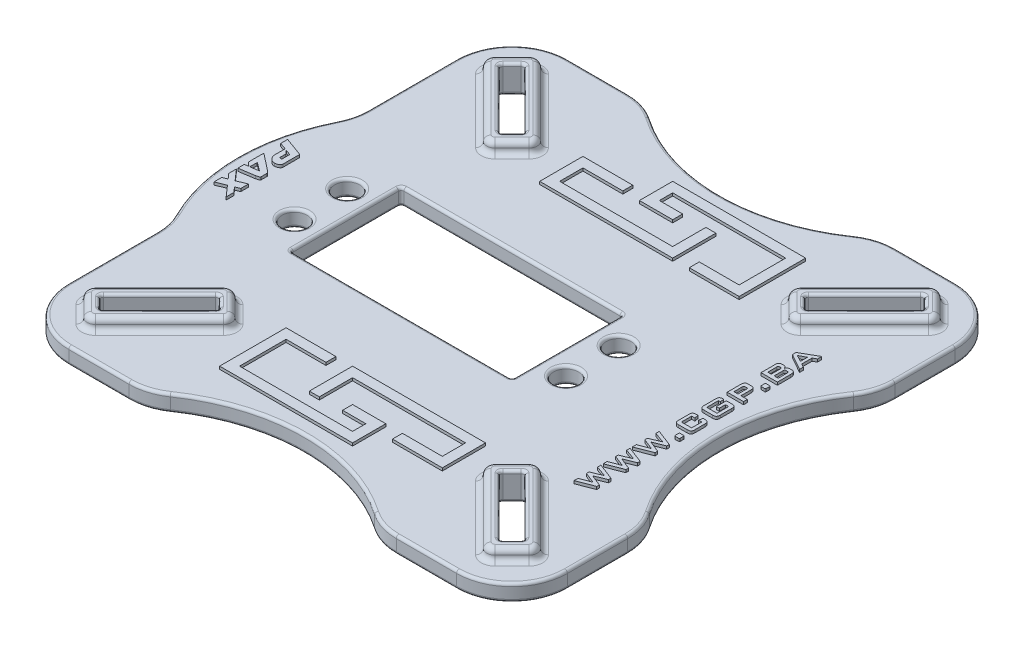
from build123d import *

# Parameters (mm, degrees)
SKETCH1_W           = 90
SKETCH1_H           = 90
SKETCH1_W_2         = 40
SKETCH1_H_2         = 20
BOSS_EXTRUDE1_DEPTH = 3
SKETCH2_R           = 2.25
CUT_EXTRUDE1_DEPTH  = 3
SKETCH3_R           = 32.5
CUT_EXTRUDE2_DEPTH  = 3
FILLET1_R           = 10
FILLET2_R           = 10
CUT_EXTRUDE3_DEPTH  = 3
FILLET3_R           = 10
BOSS_EXTRUDE2_DEPTH = 0.5
BOSS_EXTRUDE3_DEPTH = 2
FILLET4_R           = 1
BOSS_EXTRUDE4_DEPTH = 3
FILLET5_R           = 10
BOSS_EXTRUDE5_DEPTH = 0.5
BOSS_EXTRUDE6_DEPTH = 0.5
FILLET6_R           = 0.5


with BuildPart() as part:
    # Sketch1 → Boss-Extrude1 (new body)
    with BuildSketch(Plane(origin=(0, 0, 0), x_dir=(1, 0, 0), z_dir=(0, 1, 0))):
        Rectangle(SKETCH1_W, SKETCH1_H)
        with Locations((-10, 0)):
            Rectangle(SKETCH1_W_2, SKETCH1_H_2, mode=Mode.SUBTRACT)
    extrude(amount=BOSS_EXTRUDE1_DEPTH)

    # Sketch2 → Cut-Extrude1 (cut)
    with BuildSketch(Plane(origin=(0, 3, 0), x_dir=(1, 0, 0), z_dir=(0, 1, 0))):
        with Locations(Location((-34.5, 4.75, 0), (0, 0, 270))):
            Circle(SKETCH2_R)
        with Locations(Location((-34.5, -4.75, 0), (0, 0, 270))):
            Circle(SKETCH2_R)
        with Locations(Location((14.5, 4.75, 0), (0, 0, 270))):
            Circle(SKETCH2_R)
        with Locations(Location((14.5, -4.75, 0), (0, 0, 270))):
            Circle(SKETCH2_R)
    extrude(amount=-CUT_EXTRUDE1_DEPTH, mode=Mode.SUBTRACT)

    # Sketch3 → Cut-Extrude2 (cut)
    with BuildSketch(Plane(origin=(0, 3, 0), x_dir=(1, 0, 0), z_dir=(0, 1, 0))):
        with Locations((0, 70)):
            Circle(SKETCH3_R)
        with Locations((70, 0)):
            Circle(SKETCH3_R)
        with Locations((0, -70)):
            Circle(SKETCH3_R)
    extrude(amount=-CUT_EXTRUDE2_DEPTH, mode=Mode.SUBTRACT)

    # Fillet1
    fillet1_edges = [part.edges().sort_by_distance(p)[0] for p in [
        (45, 1.5, 45),
        (-45, 1.5, 45),
        (-45, 1.5, -45),
        (45, 1.5, -45),
    ]]
    fillet(fillet1_edges, radius=FILLET1_R)

    # Fillet2
    fillet2_edges = [part.edges().sort_by_distance(p)[0] for p in [
        (45, 1.5, -20.766559657),
        (45, 1.5, 20.766559657),
    ]]
    fillet(fillet2_edges, radius=FILLET2_R)

    # Sketch4 → Cut-Extrude3 (cut)
    with BuildSketch(Plane(origin=(0, 3, 0), x_dir=(1, 0, 0), z_dir=(0, 1, 0))):
        Polygon((-38.395898218, 36.062445841), (-27.577164466, 25.243712088), (-25.243712088, 27.577164466), (-36.062445841, 38.395898218), align=None)
        Polygon((36.062445841, 38.395898218), (25.243712088, 27.577164466), (27.577164466, 25.243712088), (38.395898218, 36.062445841), align=None)
        Polygon((38.395898218, -36.062445841), (27.577164466, -25.243712088), (25.243712088, -27.577164466), (36.062445841, -38.395898218), align=None)
        Polygon((-36.062445841, -38.395898218), (-25.243712088, -27.577164466), (-27.577164466, -25.243712088), (-38.395898218, -36.062445841), align=None)
    extrude(amount=-CUT_EXTRUDE3_DEPTH, mode=Mode.SUBTRACT)

    # Fillet3
    fillet3_edges = [part.edges().sort_by_distance(p)[0] for p in [
        (-20.766559657, 1.5, -45),
        (20.766559657, 1.5, -45),
        (20.766559657, 1.5, 45),
        (-20.766559657, 1.5, 45),
    ]]
    fillet(fillet3_edges, radius=FILLET3_R)

    # Sketch5 → Boss-Extrude2 (add)
    with BuildSketch(Plane(origin=(0, 3, 0), x_dir=(1, 0, 0), z_dir=(0, 1, 0))):
        Polygon((-5.804155939, -22.975641645), (-5.804155939, -30.775641645), (-4.004155939, -30.775641645), (-4.004155939, -24.775641645), (16.395844061, -24.775641645), (16.395844061, -28.975641645), (9.195844061, -28.975641645), (9.195844061, -30.775641645), (18.195844061, -30.775641645), (18.195844061, -22.975641645), align=None)
        Polygon((-17.804155939, -22.975641645), (-17.804155939, -34.975641645), (6.195844061, -34.975641645), (6.195844061, -28.975641645), (0.195844061, -28.975641645), (0.195844061, -30.775641645), (4.395844061, -30.775641645), (4.395844061, -33.175641645), (-16.004155939, -33.175641645), (-16.004155939, -24.775641645), (-8.804155939, -24.775641645), (-8.804155939, -22.975641645), align=None)
        Polygon((6.195844061, 22.80503103), (6.195844061, 30.60503103), (4.395844061, 30.60503103), (4.395844061, 24.60503103), (-16.004155939, 24.60503103), (-16.004155939, 28.80503103), (-8.804155939, 28.80503103), (-8.804155939, 30.60503103), (-17.804155939, 30.60503103), (-17.804155939, 22.80503103), align=None)
        Polygon((18.195844061, 22.80503103), (18.195844061, 34.80503103), (-5.804155939, 34.80503103), (-5.804155939, 28.80503103), (0.195844061, 28.80503103), (0.195844061, 30.60503103), (-4.004155939, 30.60503103), (-4.004155939, 33.00503103), (16.395844061, 33.00503103), (16.395844061, 24.60503103), (9.195844061, 24.60503103), (9.195844061, 22.80503103), align=None)
    extrude(amount=BOSS_EXTRUDE2_DEPTH)

    # Sketch6 → Boss-Extrude3 (add)
    # profile 1 of 4: a face of its own
    with BuildSketch(Plane(origin=(0, 3, 0), x_dir=(1, 0, 0), z_dir=(0, 1, 0))):
        with BuildLine():
            Line((-26.516504294, 23.475945135), (-23.475945135, 26.516504294))
            ThreePointArc((-23.475945135, 26.516504294), (-23.036605307, 27.577164466), (-23.475945135, 28.637824638))
            Line((-23.475945135, 28.637824638), (-35.001785669, 40.163665171))
            ThreePointArc((-35.001785669, 40.163665171), (-36.062445841, 40.603005), (-37.123106012, 40.163665171))
            Line((-37.123106012, 40.163665171), (-40.163665171, 37.123106012))
            ThreePointArc((-40.163665171, 37.123106012), (-40.603005, 36.062445841), (-40.163665171, 35.001785669))
            Line((-40.163665171, 35.001785669), (-28.637824638, 23.475945135))
            ThreePointArc((-28.637824638, 23.475945135), (-27.577164466, 23.036605307), (-26.516504294, 23.475945135))
        make_face()
        Polygon((-27.577164466, 25.243712088), (-25.243712088, 27.577164466), (-36.062445841, 38.395898218), (-38.395898218, 36.062445841), align=None, mode=Mode.SUBTRACT)
    # profile 2 of 4: a face of its own
    with BuildSketch(Plane(origin=(0, 3, 0), x_dir=(1, 0, 0), z_dir=(0, 1, 0))):
        with BuildLine():
            Line((23.475945135, 26.516504294), (26.516504294, 23.475945135))
            ThreePointArc((26.516504294, 23.475945135), (27.577164466, 23.036605307), (28.637824638, 23.475945135))
            Line((28.637824638, 23.475945135), (40.163665171, 35.001785669))
            ThreePointArc((40.163665171, 35.001785669), (40.603005, 36.062445841), (40.163665171, 37.123106012))
            Line((40.163665171, 37.123106012), (37.123106012, 40.163665171))
            ThreePointArc((37.123106012, 40.163665171), (36.062445841, 40.603005), (35.001785669, 40.163665171))
            Line((35.001785669, 40.163665171), (23.475945135, 28.637824638))
            ThreePointArc((23.475945135, 28.637824638), (23.036605307, 27.577164466), (23.475945135, 26.516504294))
        make_face()
        Polygon((25.243712088, 27.577164466), (27.577164466, 25.243712088), (38.395898218, 36.062445841), (36.062445841, 38.395898218), align=None, mode=Mode.SUBTRACT)
    # profile 3 of 4: a face of its own
    with BuildSketch(Plane(origin=(0, 3, 0), x_dir=(1, 0, 0), z_dir=(0, 1, 0))):
        with BuildLine():
            Line((26.516504294, -23.475945135), (23.475945135, -26.516504294))
            ThreePointArc((23.475945135, -26.516504294), (23.036605307, -27.577164466), (23.475945135, -28.637824638))
            Line((23.475945135, -28.637824638), (35.001785669, -40.163665171))
            ThreePointArc((35.001785669, -40.163665171), (36.062445841, -40.603005), (37.123106012, -40.163665171))
            Line((37.123106012, -40.163665171), (40.163665171, -37.123106012))
            ThreePointArc((40.163665171, -37.123106012), (40.603005, -36.062445841), (40.163665171, -35.001785669))
            Line((40.163665171, -35.001785669), (28.637824638, -23.475945135))
            ThreePointArc((28.637824638, -23.475945135), (27.577164466, -23.036605307), (26.516504294, -23.475945135))
        make_face()
        Polygon((27.577164466, -25.243712088), (25.243712088, -27.577164466), (36.062445841, -38.395898218), (38.395898218, -36.062445841), align=None, mode=Mode.SUBTRACT)
    # profile 4 of 4: a face of its own
    with BuildSketch(Plane(origin=(0, 3, 0), x_dir=(1, 0, 0), z_dir=(0, 1, 0))):
        with BuildLine():
            Line((-23.475945135, -26.516504294), (-26.516504294, -23.475945135))
            ThreePointArc((-26.516504294, -23.475945135), (-27.577164466, -23.036605307), (-28.637824638, -23.475945135))
            Line((-28.637824638, -23.475945135), (-40.163665171, -35.001785669))
            ThreePointArc((-40.163665171, -35.001785669), (-40.603005, -36.062445841), (-40.163665171, -37.123106012))
            Line((-40.163665171, -37.123106012), (-37.123106012, -40.163665171))
            ThreePointArc((-37.123106012, -40.163665171), (-36.062445841, -40.603005), (-35.001785669, -40.163665171))
            Line((-35.001785669, -40.163665171), (-23.475945135, -28.637824638))
            ThreePointArc((-23.475945135, -28.637824638), (-23.036605307, -27.577164466), (-23.475945135, -26.516504294))
        make_face()
        Polygon((-25.243712088, -27.577164466), (-27.577164466, -25.243712088), (-38.395898218, -36.062445841), (-36.062445841, -38.395898218), align=None, mode=Mode.SUBTRACT)
    extrude(amount=BOSS_EXTRUDE3_DEPTH)

    # Fillet4
    fillet4_edges = [part.edges().sort_by_distance(p)[0] for p in [
        (-27.577164466, 3, -23.036605307),
        (-34.400744905, 3, -29.238865402),
        (-40.603005, 3, -36.062445841),
        (-38.643385592, 3, -38.643385592),
        (-36.062445841, 3, -40.603005),
        (-29.238865402, 3, -34.400744905),
        (-23.036605307, 3, -27.577164466),
        (-27.577164466, 5, -23.036605307),
        (-34.400744905, 5, -29.238865402),
        (-40.603005, 5, -36.062445841),
        (-38.643385592, 5, -38.643385592),
        (-36.062445841, 5, -40.603005),
        (-29.238865402, 5, -34.400744905),
        (-23.036605307, 5, -27.577164466),
        (-24.996224715, 3, -24.996224715),
        (-24.996224715, 5, -24.996224715),
        (27.577164466, 5, -23.036605307),
        (24.996224715, 5, -24.996224715),
        (23.036605307, 5, -27.577164466),
        (29.238865402, 5, -34.400744905),
        (36.062445841, 5, -40.603005),
        (38.643385592, 5, -38.643385592),
        (40.603005, 5, -36.062445841),
        (27.577164466, 3, -23.036605307),
        (24.996224715, 3, -24.996224715),
        (23.036605307, 3, -27.577164466),
        (29.238865402, 3, -34.400744905),
        (36.062445841, 3, -40.603005),
        (38.643385592, 3, -38.643385592),
        (40.603005, 3, -36.062445841),
        (36.062445841, 5, 40.603005),
        (29.238865402, 5, 34.400744905),
        (23.036605307, 5, 27.577164466),
        (24.996224715, 5, 24.996224715),
        (27.577164466, 5, 23.036605307),
        (34.400744905, 5, 29.238865402),
        (40.603005, 5, 36.062445841),
        (36.062445841, 3, 40.603005),
        (29.238865402, 3, 34.400744905),
        (23.036605307, 3, 27.577164466),
        (24.996224715, 3, 24.996224715),
        (27.577164466, 3, 23.036605307),
        (34.400744905, 3, 29.238865402),
        (40.603005, 3, 36.062445841),
        (-36.062445841, 3, 40.603005),
        (-38.643385592, 3, 38.643385592),
        (-40.603005, 3, 36.062445841),
        (-34.400744905, 3, 29.238865402),
        (-27.577164466, 3, 23.036605307),
        (-24.996224715, 3, 24.996224715),
        (-23.036605307, 3, 27.577164466),
        (-27.577164466, 5, 23.036605307),
        (-24.996224715, 5, 24.996224715),
        (-23.036605307, 5, 27.577164466),
        (-29.238865402, 5, 34.400744905),
        (-36.062445841, 5, 40.603005),
        (-38.643385592, 5, 38.643385592),
        (-40.603005, 5, 36.062445841),
        (34.400744905, 5, -29.238865402),
        (34.400744905, 3, -29.238865402),
        (38.643385592, 5, 38.643385592),
        (38.643385592, 3, 38.643385592),
        (-29.238865402, 3, 34.400744905),
        (-34.400744905, 5, 29.238865402),
    ]]
    fillet(fillet4_edges, radius=FILLET4_R - 0.0001)  # a hair under: the kernel refuses the full size

    # Sketch7 → Boss-Extrude4 (add)
    with BuildSketch(Plane(origin=(0, 3, 0), x_dir=(1, 0, 0), z_dir=(0, 1, 0))):
        with BuildLine():
            Line((-41.273263341, 21.611540592), (-41.273263341, -21.611540592))
            ThreePointArc((-41.273263341, -21.611540592), (-49.5, 0), (-41.273263341, 21.611540592))
        make_face()
    extrude(amount=-BOSS_EXTRUDE4_DEPTH)

    # Fillet5
    fillet5_edges = [part.edges().sort_by_distance(p)[0] for p in [
        (-45, 1.5, 16.5),
        (-45, 1.5, -16.5),
    ]]
    fillet(fillet5_edges, radius=FILLET5_R)

    # Sketch8 → Boss-Extrude5 (add)
    # profile 1 of 3: a face of its own
    with BuildSketch(Plane(origin=(0, 3, 0), x_dir=(1, 0, 0), z_dir=(0, 1, 0))):
        with BuildLine():
            Line((-47.108931318, 6.608732596), (-47.108931318, 5.362670056))
            Line((-47.108931318, 5.362670056), (-45.862868778, 4.909129584))
            Line((-45.862868778, 4.909129584), (-45.862868778, 3.084638616))
            add(Edge.make_bspline(
                [(-45.862868778, 3.084638616), (-45.861736027, 3.04733525), (-45.85944029, 2.971732828), (-45.841885174, 2.857171017), (-45.811998937, 2.740671177), (-45.773186017, 2.622407022), (-45.72381782, 2.505260558), (-45.663156967, 2.392722396), (-45.594546515, 2.284139263), (-45.516969245, 2.181172785), (-45.43052043, 2.085047673), (-45.335677636, 1.997915242), (-45.233298758, 1.919289071), (-45.124349464, 1.849698208), (-45.007842689, 1.79272351), (-44.884658328, 1.752324001), (-44.755871207, 1.727004154), (-44.667942266, 1.723775492), (-44.623379289, 1.722139185)],
                knots=[0, 0, 0, 0, 0.885232018, 1.794092422, 2.74370176, 3.737504989, 4.746220302, 5.756630523, 6.768623733, 7.792411344, 8.812931898, 9.832965549, 10.844931487, 11.873452655, 12.896889759, 13.914187024, 14.942896008, 16, 16, 16, 16], degree=3))
            add(Edge.make_bspline(
                [(-44.623379289, 1.722139185), (-44.576969157, 1.724377243), (-44.477580661, 1.729170103), (-44.324379467, 1.755790649), (-44.166396505, 1.799628526), (-44.039849555, 1.856292047), (-43.946422866, 1.912456004), (-43.880593147, 1.958987768), (-43.822842666, 2.013689613), (-43.768491155, 2.070895923), (-43.722922406, 2.136125382), (-43.692502782, 2.210583451), (-43.672914278, 2.291740817), (-43.670562542, 2.348337007), (-43.669347985, 2.377566203)],
                knots=[0, 0, 0, 0, 1.308009427, 2.801135996, 4.369663069, 5.916778013, 6.688020193, 7.439397846, 8.1820322, 8.924666554, 9.660833723, 10.407644319, 11.177625268, 12, 12, 12, 12], degree=3))
            Line((-43.669347985, 2.377566203), (-43.669347985, 5.356097006))
            Line((-43.669347985, 5.356097006), (-47.108931318, 6.608732596))
        make_face()
        with BuildLine():
            Line((-44.552014742, 4.434930954), (-44.552014742, 3.104357767))
            add(Edge.make_bspline(
                [(-44.552014742, 3.104357767), (-44.553149477, 3.101471905), (-44.556335552, 3.093369063), (-44.567935861, 3.080766339), (-44.584680679, 3.062570121), (-44.615127209, 3.035603934), (-44.650765139, 3.00340377), (-44.681701473, 2.983265015), (-44.694743835, 2.974774775)],
                knots=[0, 0, 0, 0, 0.285507545, 0.801640219, 1.560352315, 2.586084273, 4.560736923, 6, 6, 6, 6], degree=3))
            add(Edge.make_bspline(
                [(-44.694743835, 2.974774775), (-44.695681011, 2.97445467), (-44.699997222, 2.972980412), (-44.707992444, 2.97113648), (-44.718255251, 2.967917144), (-44.723939854, 2.963668994), (-44.72667008, 2.961628674)],
                knots=[0, 0, 0, 0, 0.341080736, 1.57086482, 2.83332438, 4, 4, 4, 4], degree=3))
            Line((-44.72667008, 2.961628674), (-44.759535331, 2.974774775))
            add(Edge.make_bspline(
                [(-44.759535331, 2.974774775), (-44.767450483, 2.978038241), (-44.786796908, 2.986014891), (-44.816832897, 3.004977999), (-44.851997779, 3.027942728), (-44.889930934, 3.050861433), (-44.924584753, 3.076433006), (-44.955051123, 3.098136802), (-44.976440524, 3.115530801), (-44.984365981, 3.127125533), (-44.986775071, 3.130649968)],
                knots=[0, 0, 0, 0, 0.740198024, 1.809211804, 3.064644301, 4.380348615, 5.643654067, 6.787349711, 7.631392327, 8, 8, 8, 8], degree=3))
            Line((-44.986775071, 3.130649968), (-44.986775071, 4.169191919))
            Line((-44.986775071, 4.169191919), (-45.537972291, 4.791753686))
            Line((-45.537972291, 4.791753686), (-44.552014742, 4.434930954))
        make_face(mode=Mode.SUBTRACT)
    # profile 2 of 3: a face of its own
    with BuildSketch(Plane(origin=(0, 3, 0), x_dir=(1, 0, 0), z_dir=(0, 1, 0))):
        with BuildLine():
            Line((-47.108931318, -2.379444217), (-44.324775003, -1.951256939))
            add(Edge.make_bspline(
                [(-44.324775003, -1.951256939), (-44.295689199, -1.943656104), (-44.231936384, -1.926995929), (-44.130461502, -1.902643637), (-44.023365838, -1.871285088), (-43.917756706, -1.837497635), (-43.822713544, -1.795146356), (-43.753498335, -1.753181377), (-43.709771292, -1.714695617), (-43.686671907, -1.684600668), (-43.672398504, -1.65255852), (-43.670350422, -1.630556387), (-43.669347985, -1.619787401)],
                knots=[0, 0, 0, 0, 1.171376074, 2.567524768, 4.065186844, 5.519158832, 6.883790126, 8.111946179, 8.655860574, 9.143695796, 9.580880265, 10, 10, 10, 10], degree=3))
            Line((-43.669347985, -1.619787401), (-43.669347985, -0.529600055))
            add(Edge.make_bspline(
                [(-43.669347985, -0.529600055), (-43.672416061, -0.512311887), (-43.679718777, -0.471162139), (-43.720844719, -0.412660721), (-43.769549665, -0.34685948), (-43.827952777, -0.279839855), (-43.889794877, -0.215096686), (-43.951762384, -0.156591961), (-44.005618066, -0.107034392), (-44.042785701, -0.084431761), (-44.058096961, -0.075120575)],
                knots=[0, 0, 0, 0, 0.685403951, 1.631416428, 2.759305151, 3.931810397, 5.127528181, 6.288351481, 7.294883931, 8, 8, 8, 8], degree=3))
            Line((-44.058096961, -0.075120575), (-47.044139822, 2.261129311))
            Line((-47.044139822, 2.261129311), (-47.063858973, 2.261129311))
            add(Edge.make_bspline(
                [(-47.063858973, 2.261129311), (-47.063842362, 2.261453547), (-47.06368383, 2.264548055), (-47.075634168, 2.264615773), (-47.087982666, 2.269699951), (-47.101075574, 2.272559614), (-47.108931318, 2.274275412)],
                knots=[0, 0, 0, 0, 0.078778834, 0.751865482, 2.051119289, 4, 4, 4, 4], degree=3))
            Line((-47.108931318, 2.274275412), (-47.108931318, -0.471381609))
            add(Edge.make_bspline(
                [(-47.108931318, -0.471381609), (-47.104105699, -0.479949621), (-47.092483394, -0.500585326), (-47.066609674, -0.533110412), (-47.029107666, -0.570899021), (-46.967104727, -0.633897301), (-46.87539997, -0.71481517), (-46.759442619, -0.812681911), (-46.641498724, -0.90592592), (-46.547119358, -0.979255574), (-46.477286392, -1.028031408), (-46.43586052, -1.056424606), (-46.402759511, -1.075670734), (-46.383440319, -1.084649855), (-46.375566703, -1.088309332)],
                knots=[0, 0, 0, 0, 0.366921664, 0.88371573, 1.545270649, 2.355422292, 4.184658612, 6.10968203, 8.023168449, 9.800253548, 10.572220101, 11.20451281, 11.67579597, 12, 12, 12, 12], degree=3))
            Line((-46.375566703, -1.088309332), (-47.108931318, -1.224465374))
            Line((-47.108931318, -1.224465374), (-47.108931318, -2.379444217))
        make_face()
        Polygon((-46.174619165, 0.229117754), (-44.713523979, -0.861069592), (-46.239410661, -1.088309332), (-46.239410661, 0.229117754), align=None, mode=Mode.SUBTRACT)
    # profile 3 of 3: a face of its own
    with BuildSketch(Plane(origin=(0, 3, 0), x_dir=(1, 0, 0), z_dir=(0, 1, 0))):
        Polygon((-47.108931318, -4.023645805), (-46.284483006, -4.957957958), (-47.108931318, -5.295061539), (-47.108931318, -6.678219128), (-45.382097097, -5.983353808), (-43.669347985, -7.924281668), (-43.669347985, -6.535490035), (-44.480650196, -5.613384976), (-43.669347985, -5.289427496), (-43.669347985, -3.899696856), (-45.382097097, -4.594562176), (-47.108931318, -2.640488215), align=None)
    extrude(amount=BOSS_EXTRUDE5_DEPTH)

    # Sketch9 → Boss-Extrude6 (add)
    # profile 1 of 10: a face of its own
    with BuildSketch(Plane(origin=(0, 3, 0), x_dir=(1, 0, 0), z_dir=(0, 1, 0))):
        Polygon((35.029958163, 16.873825461), (32.081645446, 18.53471926), (32.081645446, 19.192002145), (35.029958163, 20.875107005), (35.029958163, 20.108414078), (34.398176866, 19.756327626), (34.398176866, 17.895534276), (35.029958163, 17.554142039), align=None)
        Polygon((33.871692453, 18.187568599), (33.871692453, 19.472519622), (32.659133037, 18.839915693), align=None, mode=Mode.SUBTRACT)
    # profile 2 of 10: a face of its own
    with BuildSketch(Plane(origin=(0, 3, 0), x_dir=(1, 0, 0), z_dir=(0, 1, 0))):
        with BuildLine():
            Line((35.029958163, 12.872543916), (32.081645446, 12.872543916))
            Line((32.081645446, 12.872543916), (32.081645446, 15.424348059))
            add(Edge.make_bspline(
                [(32.081645446, 15.424348059), (32.082178904, 15.452326389), (32.083210753, 15.506443894), (32.089398032, 15.584578226), (32.101312426, 15.65676485), (32.116080533, 15.72311247), (32.137133991, 15.783378452), (32.162270891, 15.837560316), (32.192194543, 15.885828416), (32.226349065, 15.928744631), (32.265946305, 15.965927848), (32.31126822, 15.997179992), (32.361108307, 16.024961853), (32.416775221, 16.04674482), (32.478114343, 16.06312775), (32.544386928, 16.075333373), (32.616187564, 16.082787917), (32.665695802, 16.083652946), (32.691215681, 16.08409884)],
                knots=[0, 0, 0, 0, 1.292127131, 2.499316392, 3.615120719, 4.668617248, 5.633707657, 6.557024253, 7.421415319, 8.250007142, 9.08313394, 9.919238431, 10.786314955, 11.712752044, 12.67117393, 13.714269832, 14.821780782, 16, 16, 16, 16], degree=3))
            Line((32.691215681, 16.08409884), (33.014510016, 16.08409884))
            add(Edge.make_bspline(
                [(33.014510016, 16.08409884), (33.047866265, 16.082713198), (33.112356165, 16.080034242), (33.203576399, 16.053926616), (33.284011359, 16.010903129), (33.353331241, 15.951403869), (33.410782351, 15.875524486), (33.455703457, 15.78473858), (33.488801204, 15.679482538), (33.500367383, 15.603902735), (33.506443891, 15.564195482)],
                knots=[0, 0, 0, 0, 1.005689471, 1.944367738, 2.837499614, 3.742233073, 4.681605481, 5.692907766, 6.787926245, 8, 8, 8, 8], degree=3))
            add(Edge.make_bspline(
                [(33.506443891, 15.564195482), (33.513334104, 15.603748908), (33.526538571, 15.679549444), (33.56703514, 15.784019404), (33.62074887, 15.87493371), (33.689913179, 15.950804169), (33.772575531, 16.010803023), (33.867283597, 16.054068921), (33.973692574, 16.080079824), (34.048406286, 16.082724738), (34.08722201, 16.08409884)],
                knots=[0, 0, 0, 0, 1.115241722, 2.137259083, 3.099377487, 4.039475274, 4.973823172, 5.923263124, 6.921080979, 8, 8, 8, 8], degree=3))
            Line((34.08722201, 16.08409884), (34.456583731, 16.08409884))
            add(Edge.make_bspline(
                [(34.456583731, 16.08409884), (34.480202886, 16.083510751), (34.526015156, 16.08237008), (34.592247388, 16.072327938), (34.653624056, 16.05603538), (34.710303094, 16.032748643), (34.762132564, 16.002984184), (34.810066729, 15.967448736), (34.851961262, 15.92381684), (34.890136182, 15.874367756), (34.922930288, 15.817699507), (34.951668504, 15.754851254), (34.976465098, 15.685569658), (34.995856204, 15.60920192), (35.011577407, 15.526262383), (35.02176509, 15.436341752), (35.028518795, 15.339719713), (35.029466991, 15.272996396), (35.029958163, 15.238433251)],
                knots=[0, 0, 0, 0, 0.97536779, 1.891846435, 2.760289993, 3.593432027, 4.415485166, 5.224395941, 6.04956588, 6.906104234, 7.799894245, 8.747834013, 9.758361408, 10.835533071, 11.9998569, 13.2434956, 14.57211144, 16, 16, 16, 16], degree=3))
            Line((35.029958163, 15.238433251), (35.029958163, 12.872543916))
        make_face()
        with BuildLine():
            Line((32.60812986, 15.134781632), (32.60812986, 13.556973654))
            Line((32.60812986, 13.556973654), (33.239911156, 13.556973654))
            Line((33.239911156, 13.556973654), (33.239911156, 15.134781632))
            add(Edge.make_bspline(
                [(33.239911156, 15.134781632), (33.239627422, 15.162507728), (33.23910615, 15.213445742), (33.230909879, 15.282857244), (33.218886594, 15.338948833), (33.199814255, 15.382620268), (33.173144538, 15.415152931), (33.138284535, 15.437228969), (33.09607054, 15.45058313), (33.065346078, 15.451716696), (33.049060556, 15.452317544)],
                knots=[0, 0, 0, 0, 1.562812498, 2.871178259, 3.936576838, 4.787800409, 5.534372869, 6.272243345, 7.084201431, 8, 8, 8, 8], degree=3))
            Line((33.049060556, 15.452317544), (32.79898046, 15.452317544))
            add(Edge.make_bspline(
                [(32.79898046, 15.452317544), (32.782949987, 15.451748304), (32.752725464, 15.450675035), (32.711074253, 15.436793707), (32.675801917, 15.415464094), (32.649027313, 15.38259082), (32.630161835, 15.338848687), (32.616784006, 15.283005379), (32.609052781, 15.213418185), (32.608455154, 15.162498015), (32.60812986, 15.134781632)],
                knots=[0, 0, 0, 0, 0.901900414, 1.700480689, 2.452627456, 3.200453804, 4.053107027, 5.123999521, 6.434562717, 8, 8, 8, 8], degree=3))
        make_face(mode=Mode.SUBTRACT)
        with BuildLine():
            Line((33.76639557, 15.134781632), (33.76639557, 13.556973654))
            Line((33.76639557, 13.556973654), (34.503473749, 13.556973654))
            Line((34.503473749, 13.556973654), (34.503473749, 15.134781632))
            add(Edge.make_bspline(
                [(34.503473749, 15.134781632), (34.503022525, 15.163335894), (34.502194213, 15.21575294), (34.49212427, 15.287014319), (34.474849093, 15.343850978), (34.448553733, 15.387623832), (34.411211997, 15.417757627), (34.364625356, 15.438720802), (34.307416793, 15.450297256), (34.265784325, 15.451613633), (34.24352207, 15.452317544)],
                knots=[0, 0, 0, 0, 1.422058343, 2.610471785, 3.574017487, 4.366266932, 5.113276298, 5.926342769, 6.89114706, 8, 8, 8, 8], degree=3))
            Line((34.24352207, 15.452317544), (34.023879353, 15.452317544))
            add(Edge.make_bspline(
                [(34.023879353, 15.452317544), (34.00159962, 15.451665848), (33.960202647, 15.450454962), (33.903215732, 15.438323347), (33.856437533, 15.41824028), (33.819642325, 15.387485284), (33.794194475, 15.3437499), (33.777999085, 15.286858771), (33.767586209, 15.215777124), (33.766815445, 15.163344423), (33.76639557, 15.134781632)],
                knots=[0, 0, 0, 0, 1.112017704, 2.066190281, 2.894031927, 3.632698836, 4.419968651, 5.382077697, 6.573882976, 8, 8, 8, 8], degree=3))
        make_face(mode=Mode.SUBTRACT)
    # profile 3 of 10: a face of its own
    with BuildSketch(Plane(origin=(0, 3, 0), x_dir=(1, 0, 0), z_dir=(0, 1, 0))):
        with BuildLine():
            Line((34.13493466, 11.366304914), (34.13493466, 11.470779165))
            add(Edge.make_bspline(
                [(34.13493466, 11.470779165), (34.135266523, 11.482621793), (34.135886047, 11.504729634), (34.14403873, 11.535308654), (34.158297492, 11.56001056), (34.178867573, 11.579803127), (34.207762674, 11.593759525), (34.245480871, 11.602994745), (34.292722731, 11.608454882), (34.327414124, 11.608795429), (34.346351057, 11.608981323)],
                knots=[0, 0, 0, 0, 0.968472643, 1.80794657, 2.563219161, 3.278323191, 4.112367477, 5.158759159, 6.449056578, 8, 8, 8, 8], degree=3))
            Line((34.346351057, 11.608981323), (34.815251238, 11.608981323))
            add(Edge.make_bspline(
                [(34.815251238, 11.608981323), (34.835813237, 11.608404114), (34.873195297, 11.607354737), (34.923723051, 11.602651819), (34.962141438, 11.59243853), (34.992717908, 11.577103322), (35.011638899, 11.545821445), (35.02201805, 11.501054325), (35.029042256, 11.439725856), (35.029629208, 11.39320175), (35.029958163, 11.367127546)],
                knots=[0, 0, 0, 0, 1.245223412, 2.263837154, 3.05685317, 3.651542874, 4.272716292, 5.186506804, 6.423191693, 8, 8, 8, 8], degree=3))
            Line((35.029958163, 11.367127546), (35.029958163, 10.852159978))
            add(Edge.make_bspline(
                [(35.029958163, 10.852159978), (35.029750961, 10.840274133), (35.029362811, 10.818008412), (35.019563045, 10.787658537), (35.00611581, 10.761930877), (34.984535753, 10.742494523), (34.955061008, 10.729223275), (34.91720685, 10.719998263), (34.869429536, 10.714446449), (34.834462934, 10.714131088), (34.815251238, 10.71395782)],
                knots=[0, 0, 0, 0, 0.959323733, 1.797098468, 2.56451873, 3.289113619, 4.10532656, 5.16335308, 6.441461393, 8, 8, 8, 8], degree=3))
            Line((34.815251238, 10.71395782), (34.346351057, 10.71395782))
            add(Edge.make_bspline(
                [(34.346351057, 10.71395782), (34.326339822, 10.714548402), (34.289783406, 10.715627275), (34.240314629, 10.72022325), (34.202521679, 10.730663095), (34.172171697, 10.745825808), (34.15325526, 10.777121856), (34.142874201, 10.821883041), (34.135850778, 10.883213947), (34.13526369, 10.92973763), (34.13493466, 10.955811597)],
                knots=[0, 0, 0, 0, 1.222089808, 2.232507098, 3.015994737, 3.615599952, 4.241907786, 5.163251391, 6.410158312, 8, 8, 8, 8], degree=3))
            Line((34.13493466, 10.955811597), (34.13493466, 11.366304914))
        make_face()
    # profile 4 of 10: a face of its own
    with BuildSketch(Plane(origin=(0, 3, 0), x_dir=(1, 0, 0), z_dir=(0, 1, 0))):
        with BuildLine():
            Line((35.029958163, 6.765324717), (32.081645446, 6.765324717))
            Line((32.081645446, 6.765324717), (32.081645446, 9.234043038))
            add(Edge.make_bspline(
                [(32.081645446, 9.234043038), (32.082147783, 9.263395924), (32.083116231, 9.319984911), (32.089678264, 9.401582091), (32.100360484, 9.47685593), (32.114601667, 9.546120524), (32.134648822, 9.609042297), (32.158191489, 9.665976612), (32.186137464, 9.71666302), (32.218881262, 9.761053015), (32.255962743, 9.800422899), (32.29944858, 9.83321114), (32.347654401, 9.861632568), (32.401185475, 9.884219795), (32.459786683, 9.902707616), (32.523735132, 9.915620531), (32.593152502, 9.922882357), (32.641017774, 9.923772121), (32.665714092, 9.924231199)],
                knots=[0, 0, 0, 0, 1.34793536, 2.598664309, 3.756222978, 4.838012669, 5.841634043, 6.78414457, 7.663553831, 8.492179925, 9.31156884, 10.137703396, 10.984314333, 11.875545105, 12.799534918, 13.802207839, 14.866038506, 16, 16, 16, 16], degree=3))
            Line((32.665714092, 9.924231199), (33.287623806, 9.924231199))
            add(Edge.make_bspline(
                [(33.287623806, 9.924231199), (33.312319257, 9.923776106), (33.359910186, 9.92289909), (33.428801732, 9.91567402), (33.492379769, 9.902432573), (33.551111943, 9.884405098), (33.604858742, 9.861614748), (33.653053959, 9.833205788), (33.696604005, 9.800460215), (33.733553129, 9.760789114), (33.767320629, 9.716955923), (33.795087569, 9.665932672), (33.818706429, 9.609055255), (33.838731057, 9.546116659), (33.852978951, 9.476857078), (33.863659176, 9.401581748), (33.870221796, 9.319985007), (33.87119016, 9.263395957), (33.871692453, 9.234043038)],
                knots=[0, 0, 0, 0, 1.134337726, 2.185997142, 3.176666153, 4.112987375, 5.004513844, 5.851405674, 6.67781433, 7.497475106, 8.333903515, 9.213604551, 10.156427789, 11.16038215, 12.242530762, 13.400473492, 14.651617415, 16, 16, 16, 16], degree=3))
            Line((33.871692453, 9.234043038), (33.871692453, 7.449754455))
            Line((33.871692453, 7.449754455), (35.029958163, 7.449754455))
            Line((35.029958163, 7.449754455), (35.029958163, 6.765324717))
        make_face()
        with BuildLine():
            Line((32.60812986, 8.940363451), (32.60812986, 7.449754455))
            Line((32.60812986, 7.449754455), (33.345208039, 7.449754455))
            Line((33.345208039, 7.449754455), (33.345208039, 8.940363451))
            add(Edge.make_bspline(
                [(33.345208039, 8.940363451), (33.344637349, 8.966995072), (33.343591962, 9.015778747), (33.334913526, 9.082078926), (33.321044872, 9.135399745), (33.299289844, 9.17668531), (33.268258197, 9.206923685), (33.227972759, 9.226485726), (33.178820573, 9.237745002), (33.143182035, 9.239079948), (33.123920059, 9.239801461)],
                knots=[0, 0, 0, 0, 1.469607248, 2.692019533, 3.683858234, 4.496938676, 5.235591399, 6.034456052, 6.937659538, 8, 8, 8, 8], degree=3))
            Line((33.123920059, 9.239801461), (32.826949944, 9.239801461))
            add(Edge.make_bspline(
                [(32.826949944, 9.239801461), (32.808232465, 9.239075197), (32.773402512, 9.237723747), (32.725132125, 9.226326128), (32.685077426, 9.206933424), (32.654048707, 9.176682521), (32.632292802, 9.135400708), (32.618424454, 9.082078578), (32.609745909, 9.015778864), (32.60870054, 8.966995113), (32.60812986, 8.940363451)],
                knots=[0, 0, 0, 0, 1.037970368, 1.931481147, 2.734855165, 3.477677375, 4.295347426, 5.292784776, 6.522097234, 8, 8, 8, 8], degree=3))
        make_face(mode=Mode.SUBTRACT)
    # profile 5 of 10: a face of its own
    with BuildSketch(Plane(origin=(0, 3, 0), x_dir=(1, 0, 0), z_dir=(0, 1, 0))):
        with BuildLine():
            Line((32.60812986, 4.659387062), (32.60812986, 2.553449407))
            Line((32.60812986, 2.553449407), (34.450825308, 2.553449407))
            Line((34.450825308, 2.553449407), (34.450825308, 4.659387062))
            Line((34.450825308, 4.659387062), (33.871692453, 4.659387062))
            Line((33.871692453, 4.659387062), (33.871692453, 3.553769793))
            Line((33.871692453, 3.553769793), (33.345208039, 3.553769793))
            Line((33.345208039, 3.553769793), (33.345208039, 5.3438168))
            Line((33.345208039, 5.3438168), (34.324962628, 5.3438168))
            add(Edge.make_bspline(
                [(34.324962628, 5.3438168), (34.3576131, 5.343406681), (34.420535915, 5.342616314), (34.51057279, 5.334882086), (34.592990859, 5.324149127), (34.666599857, 5.306676825), (34.73288512, 5.285762651), (34.79039845, 5.258446043), (34.840681174, 5.22734441), (34.8831337, 5.190250318), (34.91855829, 5.145754852), (34.949037422, 5.093431899), (34.974384573, 5.03193226), (34.994342206, 4.961706394), (35.011058749, 4.882881074), (35.022049621, 4.795111281), (35.028487363, 4.698422541), (35.029453764, 4.631154165), (35.029958163, 4.596044406)],
                knots=[0, 0, 0, 0, 1.287740876, 2.481687819, 3.563317017, 4.56308199, 5.462791776, 6.299975377, 7.068275841, 7.7887847, 8.511887658, 9.302262014, 10.170193235, 11.128662927, 12.178892482, 13.346275316, 14.614926642, 16, 16, 16, 16], degree=3))
            Line((35.029958163, 4.596044406), (35.029958163, 2.597048897))
            add(Edge.make_bspline(
                [(35.029958163, 2.597048897), (35.029452353, 2.562762), (35.028484245, 2.497137574), (35.022082997, 2.402904506), (35.010961111, 2.317347462), (34.994506758, 2.240648569), (34.974265866, 2.172398389), (34.948853266, 2.112603786), (34.91857053, 2.06127826), (34.883102611, 2.017599408), (34.840599675, 1.981422606), (34.790545508, 1.950930158), (34.732596656, 1.925701415), (34.666611158, 1.905163046), (34.592786086, 1.889266135), (34.510720611, 1.876465453), (34.420472088, 1.870642611), (34.357598511, 1.869574233), (34.324962628, 1.869019669)],
                knots=[0, 0, 0, 0, 1.370936796, 2.623945153, 3.774521602, 4.817517675, 5.757449821, 6.616944758, 7.408582044, 8.132975475, 8.856040047, 9.628928604, 10.468327203, 11.376846756, 12.387708688, 13.485566836, 14.694829334, 16, 16, 16, 16], degree=3))
            Line((34.324962628, 1.869019669), (32.79898046, 1.869019669))
            add(Edge.make_bspline(
                [(32.79898046, 1.869019669), (32.765794333, 1.869553395), (32.702368611, 1.870573458), (32.611051737, 1.876607083), (32.528122482, 1.889144649), (32.453007351, 1.905339194), (32.385826026, 1.925531516), (32.326851306, 1.950949573), (32.275980062, 1.981411647), (32.232651914, 2.017564317), (32.196328245, 2.061217408), (32.16520381, 2.112545413), (32.139009945, 2.172356662), (32.117711615, 2.24050191), (32.101477614, 2.31736397), (32.090583885, 2.40293814), (32.082815242, 2.497095841), (32.082046807, 2.562754676), (32.081645446, 2.597048897)],
                knots=[0, 0, 0, 0, 1.316875037, 2.516827271, 3.627751946, 4.641454711, 5.56374866, 6.406644186, 7.182863856, 7.908645129, 8.634426403, 9.425599436, 10.282837816, 11.218764033, 12.253729947, 13.395447964, 14.63961822, 16, 16, 16, 16], degree=3))
            Line((32.081645446, 2.597048897), (32.081645446, 4.596044406))
            add(Edge.make_bspline(
                [(32.081645446, 4.596044406), (32.082156009, 4.630879089), (32.08313389, 4.69759796), (32.089467067, 4.793207026), (32.100713013, 4.880114886), (32.117244683, 4.958420733), (32.137235237, 5.028630878), (32.162522658, 5.09017526), (32.193293673, 5.142539413), (32.228384237, 5.187809815), (32.270813019, 5.225334699), (32.319677286, 5.257790094), (32.376629372, 5.283666269), (32.440141048, 5.306027126), (32.511545791, 5.323122086), (32.590247888, 5.335049737), (32.676537041, 5.342585986), (32.736443697, 5.343394619), (32.767720448, 5.3438168)],
                knots=[0, 0, 0, 0, 1.397239492, 2.676132881, 3.841229059, 4.909021092, 5.883518807, 6.765964019, 7.569555421, 8.313339019, 9.053208798, 9.831098175, 10.657694253, 11.555160021, 12.528850492, 13.597548489, 14.745700715, 16, 16, 16, 16], degree=3))
            Line((32.767720448, 5.3438168), (32.84257995, 5.3438168))
            Line((32.84257995, 5.3438168), (32.976668949, 4.659387062))
            Line((32.976668949, 4.659387062), (32.60812986, 4.659387062))
        make_face()
    # profile 6 of 10: a face of its own
    with BuildSketch(Plane(origin=(0, 3, 0), x_dir=(1, 0, 0), z_dir=(0, 1, 0))):
        with BuildLine():
            Line((32.60812986, -0.184269545), (32.60812986, -2.026964993))
            Line((32.60812986, -2.026964993), (34.450825308, -2.026964993))
            Line((34.450825308, -2.026964993), (34.450825308, -0.184269545))
            Line((34.450825308, -0.184269545), (33.871692453, -0.184269545))
            Line((33.871692453, -0.184269545), (34.001668292, 0.500160193))
            Line((34.001668292, 0.500160193), (34.320849468, 0.500160193))
            add(Edge.make_bspline(
                [(34.320849468, 0.500160193), (34.353772751, 0.499752402), (34.416967098, 0.49896967), (34.507570175, 0.491249321), (34.590122035, 0.480270484), (34.664527354, 0.46403588), (34.730944101, 0.442594882), (34.789644677, 0.41687026), (34.839549012, 0.38520407), (34.882313527, 0.349160225), (34.917725251, 0.305415685), (34.948092213, 0.25413061), (34.973224271, 0.194159635), (34.994804015, 0.126239997), (35.010780051, 0.049597128), (35.022180861, -0.035625466), (35.028441892, -0.129333805), (35.029439131, -0.194680682), (35.029958163, -0.228691667)],
                knots=[0, 0, 0, 0, 1.31312886, 2.520475277, 3.625076041, 4.633631742, 5.553836211, 6.40576997, 7.182692946, 7.904107882, 8.626848645, 9.416679851, 10.274213892, 11.215249996, 12.255866525, 13.392977396, 14.643127077, 16, 16, 16, 16], degree=3))
            Line((35.029958163, -0.228691667), (35.029958163, -1.982542871))
            add(Edge.make_bspline(
                [(35.029958163, -1.982542871), (35.029450466, -2.016829182), (35.028478744, -2.082452484), (35.022102141, -2.176693209), (35.010898219, -2.262224765), (34.994638275, -2.33934209), (34.973398, -2.407643648), (34.948072927, -2.467824095), (34.91773741, -2.519131724), (34.882284644, -2.562820369), (34.839768107, -2.598973912), (34.789542372, -2.629689342), (34.730915826, -2.654684228), (34.664382964, -2.675123741), (34.590062706, -2.691260102), (34.50769119, -2.703868328), (34.416910569, -2.709809121), (34.353760623, -2.710851491), (34.320849468, -2.711394731)],
                knots=[0, 0, 0, 0, 1.366154231, 2.614791422, 3.761354043, 4.800711585, 5.751029998, 6.607526555, 7.396402185, 8.118268542, 8.838810677, 9.609002983, 10.455475132, 11.371248147, 12.37858365, 13.483415883, 14.688459825, 16, 16, 16, 16], degree=3))
            Line((34.320849468, -2.711394731), (32.784995717, -2.711394731))
            add(Edge.make_bspline(
                [(32.784995717, -2.711394731), (32.752633541, -2.710841914), (32.690306765, -2.709777237), (32.600883742, -2.703936536), (32.519618027, -2.691207515), (32.446168327, -2.674969165), (32.380045919, -2.654897908), (32.321886206, -2.62946541), (32.271825927, -2.598996103), (32.229321455, -2.562814597), (32.193865464, -2.519133428), (32.163530905, -2.467823578), (32.138205539, -2.407643809), (32.116965355, -2.33934204), (32.100705383, -2.26222478), (32.08950147, -2.176693205), (32.083124864, -2.082452486), (32.082153143, -2.016829182), (32.081645446, -1.982542871)],
                knots=[0, 0, 0, 0, 1.295769895, 2.495541679, 3.583870762, 4.585237884, 5.505324538, 6.345734957, 7.119555163, 7.843491324, 8.568757947, 9.361349481, 10.221880463, 11.176675237, 12.220928549, 13.372891916, 14.627410662, 16, 16, 16, 16], degree=3))
            Line((32.081645446, -1.982542871), (32.081645446, -0.228691667))
            add(Edge.make_bspline(
                [(32.081645446, -0.228691667), (32.082164477, -0.194680681), (32.083161716, -0.129333804), (32.08942275, -0.03562547), (32.100823551, 0.049597143), (32.116799616, 0.126239947), (32.138379266, 0.194159795), (32.163511629, 0.254130086), (32.19387759, 0.305417413), (32.229292683, 0.349154371), (32.272044561, 0.385226651), (32.32178956, 0.416641237), (32.380012399, 0.442813922), (32.446026, 0.463876391), (32.519556082, 0.480221151), (32.601007301, 0.491317031), (32.690249602, 0.49893604), (32.752621292, 0.499741904), (32.784995717, 0.500160193)],
                knots=[0, 0, 0, 0, 1.363269599, 2.619312832, 3.761784359, 4.807306644, 5.752779052, 6.614355748, 7.407910437, 8.1340584, 8.858874287, 9.639459893, 10.48540177, 11.409944338, 12.412528317, 13.500571263, 14.70265549, 16, 16, 16, 16], degree=3))
            Line((32.784995717, 0.500160193), (33.074562145, 0.500160193))
            Line((33.074562145, 0.500160193), (33.187262715, -0.184269545))
            Line((33.187262715, -0.184269545), (32.60812986, -0.184269545))
        make_face()
    # profile 7 of 10: a face of its own
    with BuildSketch(Plane(origin=(0, 3, 0), x_dir=(1, 0, 0), z_dir=(0, 1, 0))):
        with BuildLine():
            Line((34.13493466, -4.164985292), (34.13493466, -4.060511041))
            add(Edge.make_bspline(
                [(34.13493466, -4.060511041), (34.135266523, -4.048668413), (34.135886047, -4.026560572), (34.14403873, -3.995981552), (34.158297492, -3.971279646), (34.178867573, -3.951487079), (34.207762674, -3.937530681), (34.245480871, -3.928295461), (34.292722731, -3.922835323), (34.327414124, -3.922494776), (34.346351057, -3.922308882)],
                knots=[0, 0, 0, 0, 0.968472643, 1.80794657, 2.563219161, 3.278323191, 4.112367477, 5.158759159, 6.449056578, 8, 8, 8, 8], degree=3))
            Line((34.346351057, -3.922308882), (34.815251238, -3.922308882))
            add(Edge.make_bspline(
                [(34.815251238, -3.922308882), (34.835813237, -3.922886092), (34.873195297, -3.923935468), (34.923723051, -3.928638387), (34.962141438, -3.938851676), (34.992717908, -3.954186884), (35.011638899, -3.985468761), (35.02201805, -4.03023588), (35.029042256, -4.09156435), (35.029629208, -4.138088456), (35.029958163, -4.16416266)],
                knots=[0, 0, 0, 0, 1.245223412, 2.263837154, 3.05685317, 3.651542874, 4.272716292, 5.186506804, 6.423191693, 8, 8, 8, 8], degree=3))
            Line((35.029958163, -4.16416266), (35.029958163, -4.679130227))
            add(Edge.make_bspline(
                [(35.029958163, -4.679130227), (35.029750961, -4.691016073), (35.029362811, -4.713281794), (35.019563045, -4.743631668), (35.00611581, -4.769359329), (34.984535753, -4.788795683), (34.955061008, -4.802066931), (34.91720685, -4.811291943), (34.869429536, -4.816843757), (34.834462934, -4.817159117), (34.815251238, -4.817332386)],
                knots=[0, 0, 0, 0, 0.959323733, 1.797098468, 2.56451873, 3.289113619, 4.10532656, 5.16335308, 6.441461393, 8, 8, 8, 8], degree=3))
            Line((34.815251238, -4.817332386), (34.346351057, -4.817332386))
            add(Edge.make_bspline(
                [(34.346351057, -4.817332386), (34.326339822, -4.816741803), (34.289783406, -4.81566293), (34.240314629, -4.811066956), (34.202521679, -4.800627111), (34.172171697, -4.785464398), (34.15325526, -4.75416835), (34.142874201, -4.709407165), (34.135850778, -4.648076259), (34.13526369, -4.601552576), (34.13493466, -4.575478608)],
                knots=[0, 0, 0, 0, 1.222089808, 2.232507098, 3.015994737, 3.615599952, 4.241907786, 5.163251391, 6.410158312, 8, 8, 8, 8], degree=3))
            Line((34.13493466, -4.575478608), (34.13493466, -4.164985292))
        make_face()
    # profile 8 of 10: a face of its own
    with BuildSketch(Plane(origin=(0, 3, 0), x_dir=(1, 0, 0), z_dir=(0, 1, 0))):
        Polygon((35.029958163, -9.210186713), (32.081645446, -10.34541873), (32.081645446, -9.637132667), (34.059252525, -8.890182905), (32.081645446, -8.106214708), (32.081645446, -7.626620312), (34.059252525, -6.829490005), (32.081645446, -6.115445518), (32.081645446, -5.501762124), (35.029958163, -6.639462037), (35.029958163, -7.102603794), (32.990653691, -7.913718844), (35.029958163, -8.736350741), align=None)
    # profile 9 of 10: a face of its own
    with BuildSketch(Plane(origin=(0, 3, 0), x_dir=(1, 0, 0), z_dir=(0, 1, 0))):
        Polygon((35.029958163, -14.475030851), (32.081645446, -15.610262868), (32.081645446, -14.901976805), (34.059252525, -14.155027043), (32.081645446, -13.371058846), (32.081645446, -12.89146445), (34.059252525, -12.094334142), (32.081645446, -11.380289656), (32.081645446, -10.766606261), (35.029958163, -11.904306174), (35.029958163, -12.367447932), (32.990653691, -13.178562982), (35.029958163, -14.001194878), align=None)
    # profile 10 of 10: a face of its own
    with BuildSketch(Plane(origin=(0, 3, 0), x_dir=(1, 0, 0), z_dir=(0, 1, 0))):
        Polygon((35.029958163, -19.739874988), (32.081645446, -20.875107005), (32.081645446, -20.166820942), (34.059252525, -19.41987118), (32.081645446, -18.635902983), (32.081645446, -18.156308587), (34.059252525, -17.35917828), (32.081645446, -16.645133794), (32.081645446, -16.031450399), (35.029958163, -17.169150312), (35.029958163, -17.632292069), (32.990653691, -18.443407119), (35.029958163, -19.266039016), align=None)
    extrude(amount=BOSS_EXTRUDE6_DEPTH)

    # Fillet6
    fillet6_edges = [part.edges().sort_by_distance(p)[0] for p in [
        (37.5, 3, 0),
        (45, 3, -29.554563451),
        (44.548637106, 3, -21.138684274),
        (44.548637106, 3, 21.138684274),
        (37.5, 0, 0),
        (45, 0, -29.554563451),
        (44.548637106, 0, -21.138684274),
        (44.548637106, 0, 21.138684274),
        (37.229172029, 0, -37.229172029),
        (36.062445841, 2.5, -38.395898218),
        (32.986531342, 0, -30.653078964),
        (38.395898218, 2.5, -36.062445841),
        (26.410438277, 0, -26.410438277),
        (27.577164466, 2.5, -25.243712088),
        (30.653078964, 0, -32.986531342),
        (25.243712088, 2.5, -27.577164466),
        (-37.229172029, 0, -37.229172029),
        (-38.395898218, 2.5, -36.062445841),
        (-30.653078964, 0, -32.986531342),
        (-36.062445841, 2.5, -38.395898218),
        (-26.410438277, 0, -26.410438277),
        (-25.243712088, 2.5, -27.577164466),
        (-32.986531342, 0, -30.653078964),
        (-27.577164466, 2.5, -25.243712088),
        (37.229172029, 0, 37.229172029),
        (38.395898218, 2.5, 36.062445841),
        (30.653078964, 0, 32.986531342),
        (36.062445841, 2.5, 38.395898218),
        (26.410438277, 0, 26.410438277),
        (25.243712088, 2.5, 27.577164466),
        (32.986531342, 0, 30.653078964),
        (27.577164466, 2.5, 25.243712088),
        (-30, 0, 0),
        (-30, 1.5, -10),
        (-37.229172029, 0, 37.229172029),
        (-10, 0, 10),
        (-36.062445841, 2.5, 38.395898218),
        (-32.986531342, 0, 30.653078964),
        (-38.395898218, 2.5, 36.062445841),
        (-26.410438277, 0, 26.410438277),
        (-27.577164466, 2.5, 25.243712088),
        (-30.653078964, 0, 32.986531342),
        (-25.243712088, 2.5, 27.577164466),
        (-30, 1.5, 10),
        (10, 0, 0),
        (10, 1.5, 10),
        (-10, 0, -10),
        (10, 1.5, -10),
        (-30, 3, 0),
        (-10, 3, 10),
        (10, 3, 0),
        (-10, 3, -10),
        (0, 3, -37.5),
        (-29.554563451, 3, -45),
        (0, 3, 37.5),
        (29.554563451, 3, 45),
        (21.138684274, 3, 44.548637106),
        (-21.138684274, 3, 44.548637106),
        (-21.138684274, 3, -44.548637106),
        (21.138684274, 3, -44.548637106),
        (0, 0, -37.5),
        (29.554563451, 0, 45),
        (0, 0, 37.5),
        (-29.554563451, 0, -45),
        (21.138684274, 0, 44.548637106),
        (-21.138684274, 0, 44.548637106),
        (-21.138684274, 0, -44.548637106),
        (21.138684274, 0, -44.548637106),
        (-34.5, 0, -7),
        (-34.5, 3, -7),
        (-32.986531342, 5, -30.653078964),
        (-26.410438277, 5, -26.410438277),
        (-30.653078964, 5, -32.986531342),
        (-37.229172029, 5, -37.229172029),
        (-34.5, 0, 2.5),
        (30.653078964, 5, -32.986531342),
        (-34.5, 3, 2.5),
        (26.410438277, 5, -26.410438277),
        (32.986531342, 5, -30.653078964),
        (37.229172029, 5, -37.229172029),
        (14.5, 0, -7),
        (14.5, 3, -7),
        (32.986531342, 5, 30.653078964),
        (26.410438277, 5, 26.410438277),
        (30.653078964, 5, 32.986531342),
        (37.229172029, 5, 37.229172029),
        (14.5, 0, 2.5),
        (14.5, 3, 2.5),
        (-30.653078964, 5, 32.986531342),
        (-26.410438277, 5, 26.410438277),
        (-32.986531342, 5, 30.653078964),
        (-37.229172029, 5, 37.229172029),
        (-45, 3, 27.016433155),
        (-45, 0, 27.016433155),
        (-49.5, 0, 0),
        (-49.5, 3, 0),
        (-45.268305268, 0, 16.731971344),
        (-45.268305268, 3, 16.731971344),
        (-45.268305268, 3, -16.731971344),
        (-45.268305268, 0, -16.731971344),
        (-45, 0, -27.016433155),
        (-45, 3, -27.016433155),
        (45, 0, 29.554563451),
        (-29.554563451, 0, 45),
        (29.554563451, 0, -45),
        (42.071067812, 0, 42.071067812),
        (-42.071067812, 0, 42.071067812),
        (42.071067812, 0, -42.071067812),
        (-42.071067812, 0, -42.071067812),
        (29.554563451, 3, -45),
        (-29.554563451, 3, 45),
        (45, 3, 29.554563451),
        (42.071067812, 3, 42.071067812),
        (-42.071067812, 3, 42.071067812),
        (42.071067812, 3, -42.071067812),
        (-42.071067812, 3, -42.071067812),
    ]]
    fillet(fillet6_edges, radius=FILLET6_R)


solid = part.part
